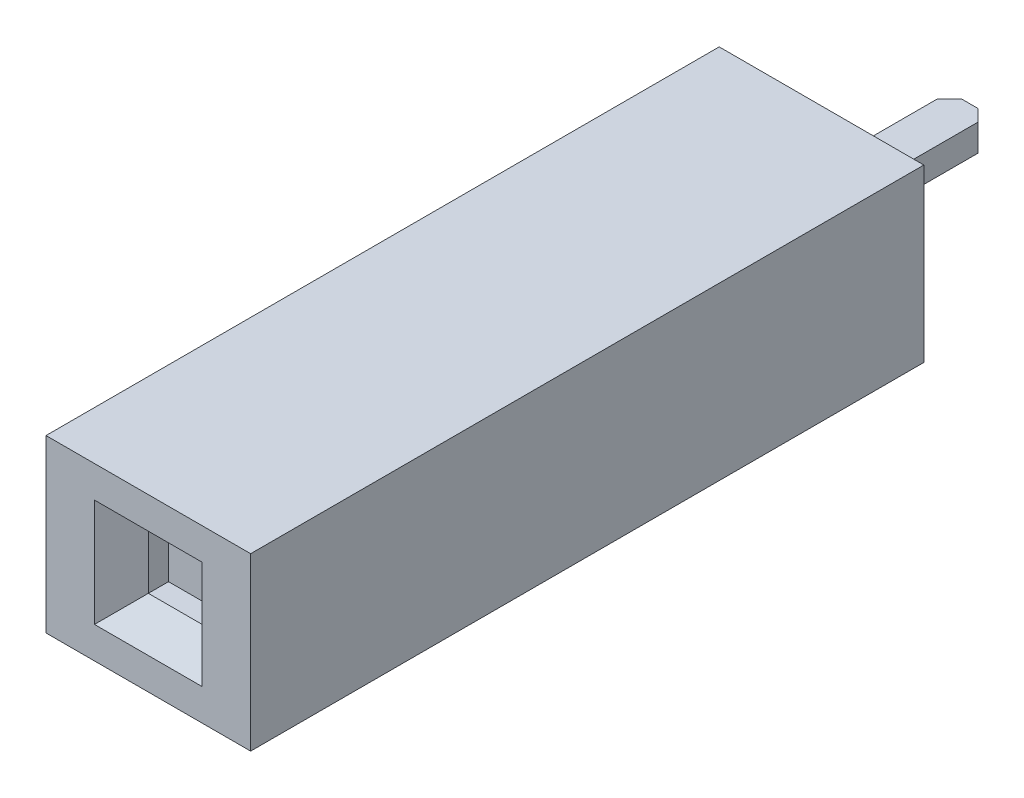
from build123d import *

# Parameters (mm, degrees)
SKETCH1_W           = 2.54
SKETCH1_H           = 10
BOSS_EXTRUDE1_DEPTH = 1.52
SKETCH2_W           = 0.8
SKETCH2_H           = 0.8
CUT_EXTRUDE1_DEPTH  = 0.7
CHAMFER_1_SIZE      = 0.4
BOSS_EXTRUDE2_DEPTH = 0.2


with BuildPart() as part:
    # Sketch1 → Boss-Extrude1 (new, symmetric)
    with BuildSketch(Plane(origin=(0, 0, 0), x_dir=(0, -1, 0), z_dir=(1, 0, 0))):
        with Locations((0, -5)):
            Rectangle(SKETCH1_W, SKETCH1_H)
    extrude(amount=BOSS_EXTRUDE1_DEPTH, both=True)

    # Sketch2 → Cut-Extrude1 (cut)
    with BuildSketch(Plane(origin=(0, 0, 10), x_dir=(-1, 0, 0), z_dir=(0, 0, 1))):
        Rectangle(SKETCH2_W, SKETCH2_H)
    extrude(amount=-CUT_EXTRUDE1_DEPTH, mode=Mode.SUBTRACT)

    # Фаска1
    chamfer_1_edges = [part.edges().sort_by_distance(p)[0] for p in [
        (-0.4, 0, 10),
        (0, -0.4, 10),
        (0.4, 0, 10),
        (0, 0.4, 10),
    ]]
    chamfer(chamfer_1_edges, length=CHAMFER_1_SIZE)

    # Sketch3 → Boss-Extrude2 (add, symmetric)
    with BuildSketch(Plane(origin=(0, 0, 0), x_dir=(1, 0, 0), z_dir=(0, 1, 0))):
        Polygon((-0.3, 0), (-0.3, 2.024264069), (-0.124264069, 2.2), (0.124264069, 2.2), (0.3, 2.024264069), (0.3, 0), align=None)
    extrude(amount=BOSS_EXTRUDE2_DEPTH, both=True)


solid = part.part
